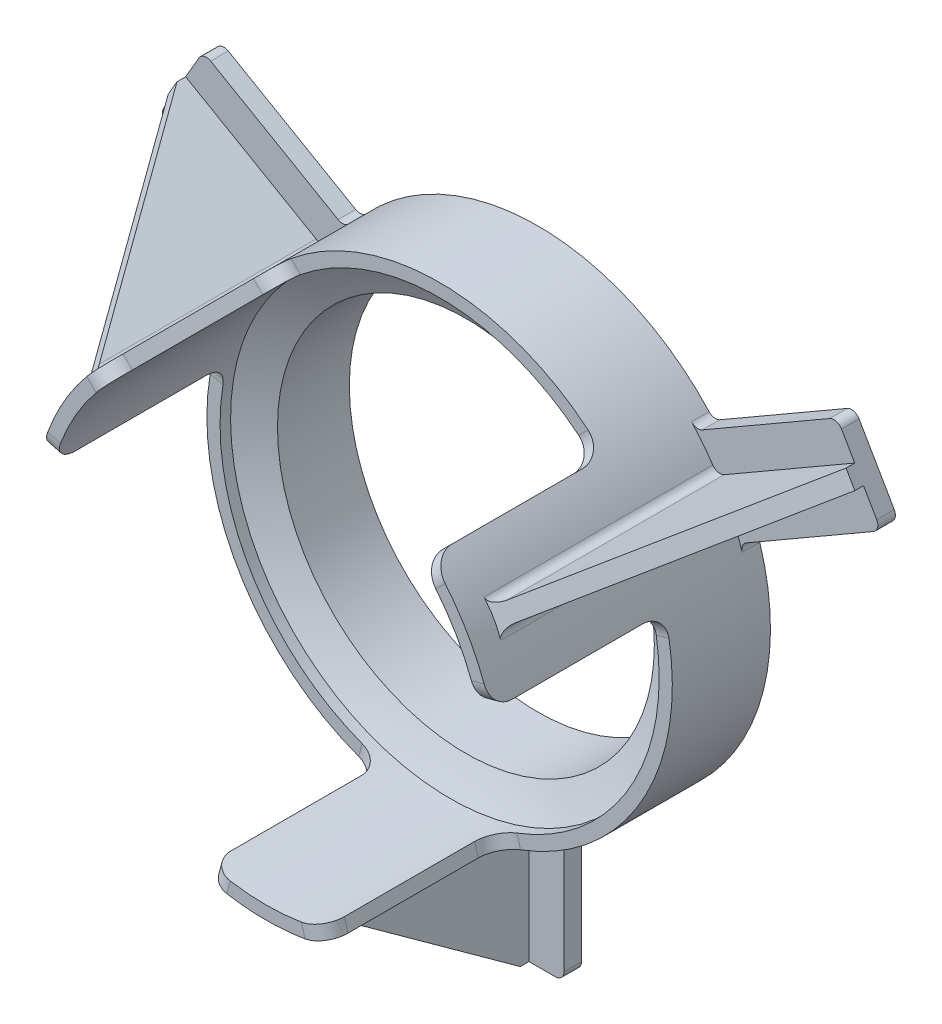
from build123d import *

# Parameters (mm, degrees)
SKETCH4_R           = 67.392050125
SKETCH4_R_2         = 64.852050125
BOSS_EXTRUDE2_DEPTH = 76.2
SKETCH5_R           = 64.852050125
BOSS_EXTRUDE3_DEPTH = 76.2
SKETCH6_R           = 41.992050125
CUT_EXTRUDE1_DEPTH  = 1484.121814024
BOSS_EXTRUDE4_DEPTH = 5.08
CIRPATTERN1_COUNT   = 3
RIB1_REACH          = 1339.05
SKETCH8_WALL_W      = 2754.475682116
SKETCH8_WALL_H      = 5.08
CIRPATTERN2_COUNT   = 3
SCALE1_SCALE        = 1.01
FILLET3_R           = 2.54
BOSS_EXTRUDE5_START = 2.54
SKETCH11_R          = 42.411970626
BOSS_EXTRUDE5_DEPTH = 2.54
CUT_EXTRUDE2_START  = -50.8
CUT_EXTRUDE2_DEPTH  = 50.8
CIRPATTERN3_COUNT   = 3
FILLET4_R           = 6.35
FILLET6_R           = 2.54
CUT_EXTRUDE4_START  = -2.54
CUT_EXTRUDE4_DEPTH  = 2.54
SKETCH18_R          = 55.111970626
CUT_EXTRUDE5_DEPTH  = 1543.609883784


# Read off the part's stored shape, not the designer's step: Cavity2
with BuildPart() as part:
    # Sketch4 → Boss-Extrude2 (new body)
    with BuildSketch(Plane.XY.offset(-101.6)):
        with Locations(Location((672.464575935, -1215.750984812, 0), (0, 0, 180))):
            Circle(SKETCH4_R)
        with Locations(Location((672.464575935, -1215.750984812, 0), (0, 0, 180))):
            Circle(SKETCH4_R_2, mode=Mode.SUBTRACT)
    extrude(amount=BOSS_EXTRUDE2_DEPTH)

    # Sketch5 → Boss-Extrude3 (add)
    with BuildSketch(Plane(origin=(0, 0, -101.6), x_dir=(-1, 0, 0), z_dir=(0, 0, -1))):
        with Locations((-672.464575935, -1215.750984812)):
            Circle(SKETCH5_R)
    extrude(amount=-BOSS_EXTRUDE3_DEPTH)

    # Cavity2 outline → Cavity2 (revolve, cut)
    with BuildSketch(Plane(origin=(672.464575935, -1215.750984812, 0), x_dir=(1, 0, 0), z_dir=(0, -1, 0))):
        with BuildLine():
            Line((63.582050239, -78.739999936), (63.582050125, -25.4))
            Line((63.582050125, -25.4), (0, -25.4))
            Line((0, -25.4), (0, -95.25))
            ThreePointArc((0, -95.25), (32.845308701, -91.05517631), (63.582050239, -78.739999936))
        make_face()
    revolve(axis=Axis((672.464575935, -1215.750984812, 0), (0, 0, 1)), mode=Mode.SUBTRACT)

    # Sketch6 → Cut-Extrude1 (cut, through all)
    with BuildSketch(Plane.XY.offset(-25.4)):
        with Locations((672.464575935, -1215.750984812)):
            Circle(SKETCH6_R)
    extrude(amount=-CUT_EXTRUDE1_DEPTH, mode=Mode.SUBTRACT)

    # Sketch7 → Boss-Extrude4 (add)
    with BuildSketch(Plane(origin=(0, 0, -101.6), x_dir=(-1, 0, 0), z_dir=(0, 0, -1))):
        with BuildLine():
            Line((-659.764575935, -1281.935563227), (-659.764575935, -1329.082655371))
            Line((-659.764575935, -1329.082655371), (-685.164575935, -1329.082655371))
            Line((-685.164575935, -1329.082655371), (-685.164575935, -1281.935563227))
            ThreePointArc((-685.164575935, -1281.935563227), (-672.464575935, -1283.143034937), (-659.764575935, -1281.935563227))
        make_face()
    boss_extrude4 = extrude(amount=-BOSS_EXTRUDE4_DEPTH)

    # CirPattern1: Boss-Extrude4 ×3 about axis
    cirpattern1_axis = Axis((672.464575935, -1215.750984812, 0), (0, 0, 1))
    for i in range(1, CIRPATTERN1_COUNT):
        add(boss_extrude4.rotate(cirpattern1_axis, i * 360 / CIRPATTERN1_COUNT))

    # Sketch8 wall → Rib1 (add, up to next)
    with BuildSketch(Plane(origin=(672.464575935, -1306.112845154, -64.77), x_dir=(0, 0.586148684834, 0.810203504847), z_dir=(0, -0.810203504847, 0.586148684834)), mode=Mode.PRIVATE) as rib1_sk1:
        Rectangle(SKETCH8_WALL_W, SKETCH8_WALL_H)
    rib1_tool1 = extrude(rib1_sk1.sketch, amount=-RIB1_REACH, mode=Mode.PRIVATE) - part.part
    rib1 = rib1_tool1.solids().sort_by_distance((672.464575935, -1306.112845154, -64.77))[0]
    add(rib1)

    # CirPattern2: Rib1 ×3 about axis
    cirpattern2_axis = Axis((672.464575935, -1215.750984812, 0), (0, 0, 1))
    for i in range(1, CIRPATTERN2_COUNT):
        add(rib1.rotate(cirpattern2_axis, i * 360 / CIRPATTERN2_COUNT))


with BuildPart() as part_1:
    # Scale1: scaled about (672.464575938, -1215.75098481, -79.529300262)
    add(part.part.scale(SCALE1_SCALE).moved(Location((-6.724645759, 12.157509848, 0.795293003))))

    # Fillet3
    fillet3_edges = [part_1.edges().sort_by_distance(p)[0] for p in [
        (612.27689898, -1183.96388208, -64.588982815),
        (614.84229898, -1179.520478938, -64.588982815),
        (730.086852891, -1179.520478939, -64.588982815),
        (732.652252891, -1183.963882081, -64.588982815),
        (675.029975935, -1283.768593415, -64.588982815),
        (669.899175935, -1283.768593415, -64.588982815),
    ]]
    fillet(fillet3_edges, radius=FILLET3_R)

    # Sketch11 → Boss-Extrude5 (add)
    with BuildSketch(Plane(origin=(0, 0, -101.820706998), x_dir=(-1, 0, 0), z_dir=(0, 0, -1)).offset(BOSS_EXTRUDE5_START)):
        with BuildLine():
            Line((-566.92148912, -1169.626999033), (-579.74848912, -1147.409983325))
            Line((-579.74848912, -1147.409983325), (-620.987374426, -1171.219264857))
            ThreePointArc((-620.987374426, -1171.219264857), (-672.464575935, -1147.685014185), (-723.941777445, -1171.219264857))
            Line((-723.941777445, -1171.219264857), (-765.180662751, -1147.409983325))
            Line((-765.180662751, -1147.409983325), (-778.007662751, -1169.626999033))
            Line((-778.007662751, -1169.626999033), (-736.768777445, -1193.436280566))
            ThreePointArc((-736.768777445, -1193.436280566), (-731.411435631, -1249.783970125), (-685.291575935, -1282.597409011))
            Line((-685.291575935, -1282.597409011), (-685.291575935, -1330.215972077))
            Line((-685.291575935, -1330.215972077), (-659.637575935, -1330.215972077))
            Line((-659.637575935, -1330.215972077), (-659.637575935, -1282.597409011))
            ThreePointArc((-659.637575935, -1282.597409011), (-613.51771624, -1249.783970125), (-608.160374426, -1193.436280566))
            Line((-608.160374426, -1193.436280566), (-566.92148912, -1169.626999033))
        make_face()
        with Locations(Location((-672.464575935, -1215.750984812, 0), (0, 0, 180))):
            Circle(SKETCH11_R, mode=Mode.SUBTRACT)
    extrude(amount=-BOSS_EXTRUDE5_DEPTH)

    # Sketch12 → Cut-Extrude2 (cut)
    with BuildSketch(Plane.XY.offset(-24.858706998).offset(CUT_EXTRUDE2_START)):
        with BuildLine():
            Line((610.434876188, -1199.130176857), (606.717897016, -1198.13421529))
            ThreePointArc((606.717897016, -1198.13421529), (604.980919123, -1224.635376777), (613.51771624, -1249.783970125))
            Line((613.51771624, -1249.783970125), (616.850268596, -1247.859920125))
            ThreePointArc((616.850268596, -1247.859920125), (608.796098094, -1224.133098937), (610.434876188, -1199.130176857))
        make_face()
        with BuildLine():
            Line((616.850268596, -1247.859920125), (613.51771624, -1249.783970125))
            ThreePointArc((613.51771624, -1249.783970125), (631.02863839, -1269.751349968), (654.847806414, -1281.497663731))
            Line((654.847806414, -1281.497663731), (655.843767981, -1277.780684559))
            ThreePointArc((655.843767981, -1277.780684559), (633.371213245, -1266.698446979), (616.850268596, -1247.859920125))
        make_face()
    cut_extrude2 = extrude(amount=CUT_EXTRUDE2_DEPTH, mode=Mode.SUBTRACT)

    # CirPattern3: Cut-Extrude2 ×3 about axis
    cirpattern3_axis = Axis((672.464575935, -1215.750984812, 0), (0, 0, 1))
    for i in range(1, CIRPATTERN3_COUNT):
        add(cut_extrude2.rotate(cirpattern3_axis, i * 360 / CIRPATTERN3_COUNT), mode=Mode.SUBTRACT)

    # Fillet4
    fillet4_edges = [part_1.edges().sort_by_distance(p)[0] for p in [
        (655.345787198, -1279.639174145, -24.858706998),
        (608.576386602, -1198.632196074, -75.658706998),
        (655.345787198, -1279.639174145, -75.658706998),
        (608.576386602, -1198.632196074, -24.858706998),
        (625.69517534, -1168.981584216, -24.858706998),
        (719.233976531, -1168.981584216, -75.658706998),
        (625.69517534, -1168.981584216, -75.658706998),
        (719.233976531, -1168.981584216, -24.858706998),
        (736.352765269, -1198.632196074, -24.858706998),
        (689.583364673, -1279.639174145, -75.658706998),
        (736.352765269, -1198.632196074, -75.658706998),
        (689.583364673, -1279.639174145, -24.858706998),
    ]]
    fillet(fillet4_edges, radius=FILLET4_R)

    # Fillet6
    fillet6_edges = [part_1.edges().sort_by_distance(p)[0] for p in [
        (659.637575935, -1330.215972077, -99.255306997),
        (685.291575935, -1330.215972077, -99.255306997),
        (685.291575935, -1282.597409011, -99.255306997),
        (659.637575935, -1282.597409011, -99.255306997),
        (579.74848912, -1147.409983325, -99.255306997),
        (566.92148912, -1169.626999033, -99.255306997),
        (608.160374426, -1193.436280566, -99.255306997),
        (620.987374426, -1171.219264857, -99.255306997),
        (778.007662751, -1169.626999033, -99.255306997),
        (765.180662751, -1147.409983325, -99.255306997),
        (723.941777445, -1171.219264857, -99.255306997),
        (736.768777445, -1193.436280566, -99.255306997),
    ]]
    fillet(fillet6_edges, radius=FILLET6_R)

    # Sketch17 → Cut-Extrude4 (cut)
    with BuildSketch(Plane.XY.offset(-96.689906998).offset(CUT_EXTRUDE4_START)):
        with BuildLine():
            Line((675.029975935, -1330.215972077), (682.751575935, -1330.215972077))
            ThreePointArc((682.751575935, -1330.215972077), (684.54762716, -1329.472023301), (685.291575935, -1327.675972077))
            Line((685.291575935, -1327.675972077), (685.291575935, -1284.664397143))
            ThreePointArc((685.291575935, -1284.664397143), (685.849688559, -1283.075774335), (687.278758948, -1282.185285734))
            ThreePointArc((687.278758948, -1282.185285734), (682.359261132, -1283.093924769), (677.386312771, -1283.638780945))
            ThreePointArc((677.386312771, -1283.638780945), (675.710123194, -1284.442233854), (675.029975935, -1286.172132054))
            Line((675.029975935, -1286.172132054), (675.029975935, -1330.215972077))
        make_face()
        with BuildLine():
            Line((659.637575935, -1284.664397143), (659.637575935, -1327.675972077))
            ThreePointArc((659.637575935, -1327.675972077), (660.381524711, -1329.472023301), (662.177575935, -1330.215972077))
            Line((662.177575935, -1330.215972077), (669.899175935, -1330.215972077))
            Line((669.899175935, -1330.215972077), (669.899175935, -1286.172132054))
            ThreePointArc((669.899175935, -1286.172132054), (669.219028677, -1284.442233854), (667.5428391, -1283.638780945))
            ThreePointArc((667.5428391, -1283.638780945), (662.569890739, -1283.093924769), (657.650392923, -1282.185285734))
            ThreePointArc((657.650392923, -1282.185285734), (659.079463312, -1283.075774335), (659.637575935, -1284.664397143))
        make_face()
        with BuildLine():
            Line((572.05228912, -1160.74019275), (568.19148912, -1167.427294508))
            ThreePointArc((568.19148912, -1167.427294508), (567.937742047, -1169.354694882), (569.121193645, -1170.896999033))
            Line((569.121193645, -1170.896999033), (606.370310195, -1192.4027865))
            ThreePointArc((606.370310195, -1192.4027865), (607.467041592, -1193.680437614), (607.523692148, -1195.363293175))
            ThreePointArc((607.523692148, -1195.363293175), (609.196536568, -1190.648563575), (611.211151459, -1186.069435875))
            ThreePointArc((611.211151459, -1186.069435875), (611.353435617, -1184.216086665), (610.19537346, -1182.762112761))
            Line((610.19537346, -1182.762112761), (572.05228912, -1160.74019275))
        make_face()
        with BuildLine():
            Line((619.197310195, -1170.185770792), (581.948193645, -1148.679983325))
            ThreePointArc((581.948193645, -1148.679983325), (580.020793271, -1148.426236251), (578.47848912, -1149.60968785))
            Line((578.47848912, -1149.60968785), (574.61768912, -1156.296789608))
            Line((574.61768912, -1156.296789608), (612.76077346, -1178.318709619))
            ThreePointArc((612.76077346, -1178.318709619), (614.598982876, -1178.594633915), (616.132888295, -1177.544737615))
            ThreePointArc((616.132888295, -1177.544737615), (619.091221765, -1173.51046609), (622.33787516, -1169.704375526))
            ThreePointArc((622.33787516, -1169.704375526), (620.852154215, -1170.496742486), (619.197310195, -1170.185770792))
        make_face()
        with BuildLine():
            Line((770.311462751, -1156.296789608), (766.450662751, -1149.60968785))
            ThreePointArc((766.450662751, -1149.60968785), (764.9083586, -1148.426236251), (762.980958225, -1148.679983325))
            Line((762.980958225, -1148.679983325), (725.731841676, -1170.185770792))
            ThreePointArc((725.731841676, -1170.185770792), (724.076997655, -1170.496742486), (722.59127671, -1169.704375526))
            ThreePointArc((722.59127671, -1169.704375526), (725.837930106, -1173.51046609), (728.796263576, -1177.544737615))
            ThreePointArc((728.796263576, -1177.544737615), (730.330168995, -1178.594633915), (732.168378411, -1178.318709619))
            Line((732.168378411, -1178.318709619), (770.311462751, -1156.296789608))
        make_face()
        with BuildLine():
            Line((738.558841676, -1192.4027865), (775.807958225, -1170.896999033))
            ThreePointArc((775.807958225, -1170.896999033), (776.991409824, -1169.354694882), (776.737662751, -1167.427294508))
            Line((776.737662751, -1167.427294508), (772.876862751, -1160.74019275))
            Line((772.876862751, -1160.74019275), (734.733778411, -1182.762112761))
            ThreePointArc((734.733778411, -1182.762112761), (733.575716254, -1184.216086665), (733.718000412, -1186.069435875))
            ThreePointArc((733.718000412, -1186.069435875), (735.732615303, -1190.648563575), (737.405459723, -1195.363293175))
            ThreePointArc((737.405459723, -1195.363293175), (737.462110279, -1193.680437614), (738.558841676, -1192.4027865))
        make_face()
    extrude(amount=CUT_EXTRUDE4_DEPTH, mode=Mode.SUBTRACT)

    # Sketch18 → Cut-Extrude5 (cut, through all)
    with BuildSketch(Plane(origin=(0, 0, -104.360706998), x_dir=(-1, 0, 0), z_dir=(0, 0, -1))):
        with Locations((-672.464575935, -1215.750984812)):
            Circle(SKETCH18_R)
    extrude(amount=-CUT_EXTRUDE5_DEPTH, mode=Mode.SUBTRACT)


solid = part_1.part
